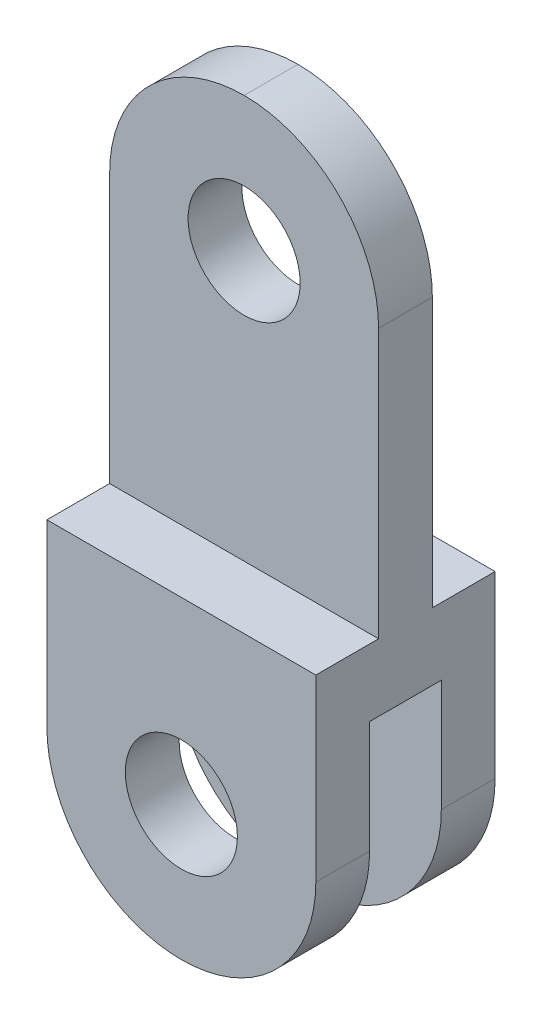
from build123d import *

# Parameters (mm, degrees)
BOSS_EXTRUDE1_DEPTH     = 30
FILLET1_R               = 30
CUT_EXTRUDE1_DEPTH      = 117.297033496
CUT_EXTRUDE1_DEPTH_BACK = 117.297033496
SKETCH3_R               = 12.5


with BuildPart() as part:
    # Sketch1 → Boss-Extrude1 (new, symmetric)
    with BuildSketch(Plane.YZ):
        Polygon((0, -8), (0, 8), (-55, 8), (-55, 20), (15, 20), (15, 6), (105, 6), (105, -6), (15, -6), (15, -20), (-55, -20), (-55, -8), align=None)
    extrude(amount=BOSS_EXTRUDE1_DEPTH, both=True)

    # Fillet1
    fillet1_edges = [part.edges().sort_by_distance(p)[0] for p in [
        (-30, 105, 0),
        (30, 105, 0),
        (30, -55, -14),
        (-30, -55, -14),
        (-30, -55, 14),
        (30, -55, 14),
    ]]
    fillet(fillet1_edges, radius=FILLET1_R - 0.0001)  # a hair under: the kernel refuses the full size

    # Sketch3 → Cut-Extrude1 (cut, two sides: drawn at the far end of the back side and taken through both)
    with BuildSketch(Plane.XY.offset(20).offset(-CUT_EXTRUDE1_DEPTH_BACK)):
        with Locations((0, -25)):
            Circle(SKETCH3_R)
        with Locations((0, 75)):
            Circle(SKETCH3_R)
    extrude(amount=CUT_EXTRUDE1_DEPTH + CUT_EXTRUDE1_DEPTH_BACK, mode=Mode.SUBTRACT)


solid = part.part
